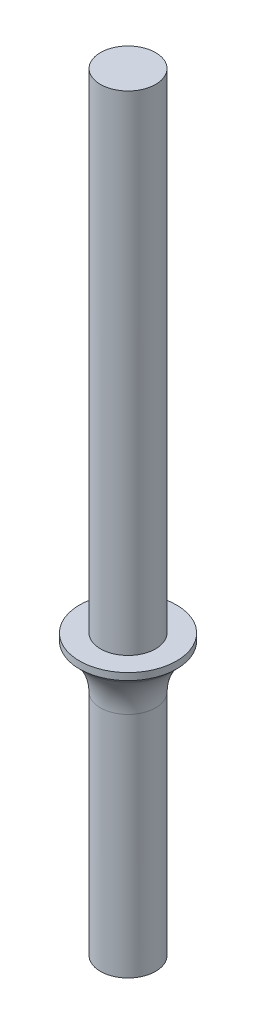
from build123d import *

# Parameters (mm, degrees)
SKETCH1_R           = 3.95
BOSS_EXTRUDE1_DEPTH = 110
SKETCH2_R           = 6.95
BOSS_EXTRUDE2_DEPTH = 1
CHAMFER1_SIZE       = 3
FILLET1_R           = 8


with BuildPart() as part:
    # Sketch1 → Boss-Extrude1 (new body)
    with BuildSketch(Plane(origin=(0, 0, 0), x_dir=(1, 0, 0), z_dir=(0, 1, 0))):
        with Locations(Location((0, 0, 0), (0, 0, 270))):
            Circle(SKETCH1_R)
    extrude(amount=BOSS_EXTRUDE1_DEPTH)

    # Sketch2 → Boss-Extrude2 (add)
    with BuildSketch(Plane(origin=(0, 39, 0), x_dir=(-1, 0, 0), z_dir=(0, -1, 0))):
        with Locations(Location((0, 0, 0), (0, 0, 90))):
            Circle(SKETCH2_R)
    extrude(amount=-BOSS_EXTRUDE2_DEPTH)

    # Chamfer1
    chamfer1_edges = [part.edges().sort_by_distance(p)[0] for p in [
        (0, 39, -3.95),
    ]]
    chamfer(chamfer1_edges, length=CHAMFER1_SIZE - 0.0001)  # a hair under: the kernel refuses the full size

    # Fillet1
    fillet1_edges = [part.edges().sort_by_distance(p)[0] for p in [
        (0, 36.0001, -3.95),
    ]]
    fillet(fillet1_edges, radius=FILLET1_R)


solid = part.part
